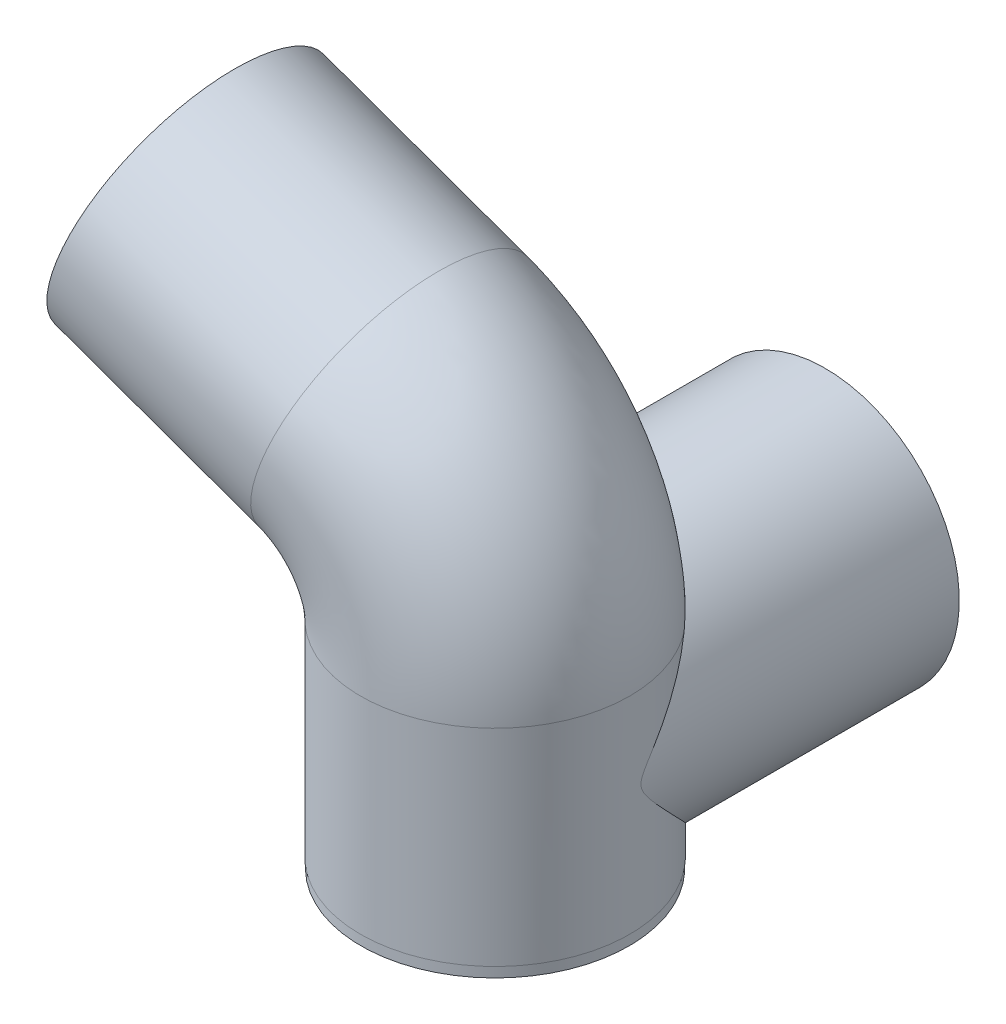
from build123d import *
from build123d.topology import SkipClean

# Parameters (mm, degrees)
CROQUIS1_R                          = 13
CROQUIS1_R_2                        = 11.05
SALIENTE_EXTRUIR1_DEPTH             = 1
BARRER_L_MINA1_PROFILE_R            = 13.05
BARRER_L_MINA1_PROFILE_R_2          = 11.05
CROQUIS19_R                         = 13
CROQUIS19_R_2                       = 11.05
SALIENTE_EXTRUIR2_DEPTH             = 14
SALIENTE_EXTRUIR2_DIRECTION_2_REACH = 73.397
CORTAR_EXTRUIR1_START               = -32.0000001
CORTAR_EXTRUIR1_OUTLINE_R           = 11.05
CORTAR_EXTRUIR1_DEPTH               = 32.0000001


with BuildPart() as part:
    # Croquis1 → Saliente-Extruir1 (new body)
    with BuildSketch(Plane(origin=(0, 0, 0), x_dir=(1, 0, 0), z_dir=(0, 1, 0))):
        with Locations(Location((0, 0, 0), (0, 0, 270))):
            Circle(CROQUIS1_R)
        with Locations(Location((0, 0, 0), (0, 0, 270))):
            Circle(CROQUIS1_R_2, mode=Mode.SUBTRACT)
    extrude(amount=SALIENTE_EXTRUIR1_DEPTH)

    # Barrer-Lámina1: sweep along a path in Croquis2
    with BuildLine(Plane.XY) as barrer_l_mina1_path:
        Line((0, 1), (0, 21))
        ThreePointArc((0, 21), (-2.727754239, 29.625078781), (-9.918931196, 35.113211534))
        Line((-9.918931196, 35.113211534), (-29.677427344, 42.226707859))
    # Barrer-Lámina1 profile (on start of the path) → Barrer-Lámina1 (sweep)
    with BuildSketch(Plane.ZX.offset(1)):
        Circle(BARRER_L_MINA1_PROFILE_R)
        Circle(BARRER_L_MINA1_PROFILE_R_2, mode=Mode.SUBTRACT)
    sweep(path=barrer_l_mina1_path.line)

    # Croquis19 → Saliente-Extruir2 (add)
    with BuildSketch(Plane(origin=(0, 0, -18), x_dir=(-1, 0, 0), z_dir=(0, 0, -1))):
        with Locations((0, 13)):
            Circle(CROQUIS19_R)
        with Locations((0, 13)):
            Circle(CROQUIS19_R_2, mode=Mode.SUBTRACT)
    extrude(amount=SALIENTE_EXTRUIR2_DEPTH)

    # Croquis19 → Saliente-Extruir2 direction 2 (add, up to next)
    with BuildSketch(Plane(origin=(0, 0, -18), x_dir=(-1, 0, 0), z_dir=(0, 0, -1)), mode=Mode.PRIVATE) as saliente_extruir2_direction_2_sk1:
        with Locations((0, 13)):
            Circle(CROQUIS19_R)
        with Locations((0, 13)):
            Circle(CROQUIS19_R_2, mode=Mode.SUBTRACT)
    saliente_extruir2_direction_2_tool1 = extrude(saliente_extruir2_direction_2_sk1.sketch, amount=-SALIENTE_EXTRUIR2_DIRECTION_2_REACH, mode=Mode.PRIVATE) - part.part
    add(saliente_extruir2_direction_2_tool1.solids().sort_by_distance((12.632304, 13, -18))[0])

    # Cortar-Extruir1: read off the stored shape, not the designer's step
    # Cortar-Extruir1 outline → Cortar-Extruir1 (cut)
    with SkipClean():  # the faces are left unmerged after this step: merging them gives an invalid solid
        with BuildSketch(Plane(origin=(0, 0, -32), x_dir=(-1, 0, 0), z_dir=(0, 0, -1)).offset(CORTAR_EXTRUIR1_START)):
            with Locations((0, 13)):
                Circle(CORTAR_EXTRUIR1_OUTLINE_R)
        extrude(amount=CORTAR_EXTRUIR1_DEPTH, mode=Mode.SUBTRACT)


solid = part.part
